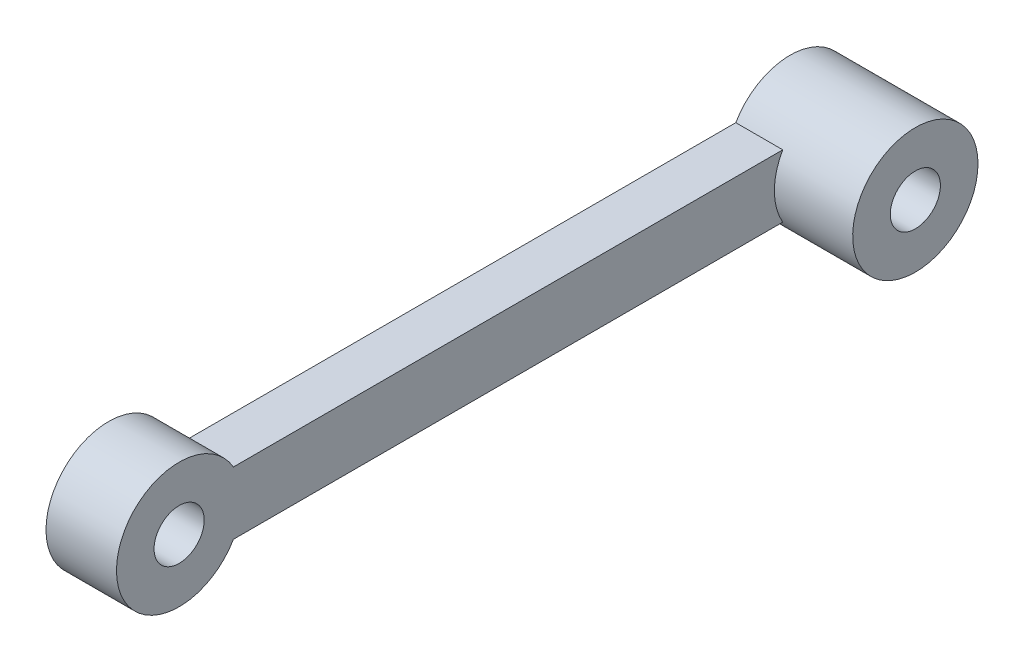
from build123d import *
from build123d.topology import SkipClean

# Parameters (mm, degrees)
SKETCH1_R           = 1.6
BOSS_EXTRUDE1_DEPTH = 3
BOSS_EXTRUDE2_START = 1.5
SKETCH2_R           = 4
SKETCH2_R_2         = 1.6
BOSS_EXTRUDE2_DEPTH = 1.5
SKETCH3_R           = 4
SKETCH3_R_2         = 1.6
BOSS_EXTRUDE3_DEPTH = 5


with BuildPart() as part:
    # Sketch1 → Boss-Extrude1 (new body)
    with BuildSketch(Plane(origin=(0, 0, 0), x_dir=(0, 0, -1), z_dir=(1, 0, 0))):
        with BuildLine():
            Line((21, 2), (38.535898385, 2))
            ThreePointArc((38.535898385, 2), (46, 0), (38.535898385, -2))
            Line((38.535898385, -2), (21, -2))
            Line((21, -2), (3.464101615, -2))
            ThreePointArc((3.464101615, -2), (-4, 0), (3.464101615, 2))
            Line((3.464101615, 2), (21, 2))
        make_face()
        Circle(SKETCH1_R, mode=Mode.SUBTRACT)
        with Locations((42, 0)):
            Circle(SKETCH1_R, mode=Mode.SUBTRACT)
    extrude(amount=BOSS_EXTRUDE1_DEPTH)

    # Sketch2 → Boss-Extrude2 (add)
    with SkipClean():  # the faces are left unmerged after this step: merging them gives an invalid solid
        with BuildSketch(Plane.ZY.offset(BOSS_EXTRUDE2_START)):
            Circle(SKETCH2_R)
            Circle(SKETCH2_R_2, mode=Mode.SUBTRACT)
        extrude(amount=-BOSS_EXTRUDE2_DEPTH)

    # Sketch3 → Boss-Extrude3 (add)
    with SkipClean():  # the faces are left unmerged after this step: merging them gives an invalid solid
        with BuildSketch(Plane(origin=(3, 0, 0), x_dir=(0, 0, -1), z_dir=(1, 0, 0))):
            with Locations((42, 0)):
                Circle(SKETCH3_R)
            with Locations((42, 0)):
                Circle(SKETCH3_R_2, mode=Mode.SUBTRACT)
        extrude(amount=BOSS_EXTRUDE3_DEPTH)
    add(part.part.scale(1), mode=Mode.REPLACE)  # the faces are merged on a copy


solid = part.part
